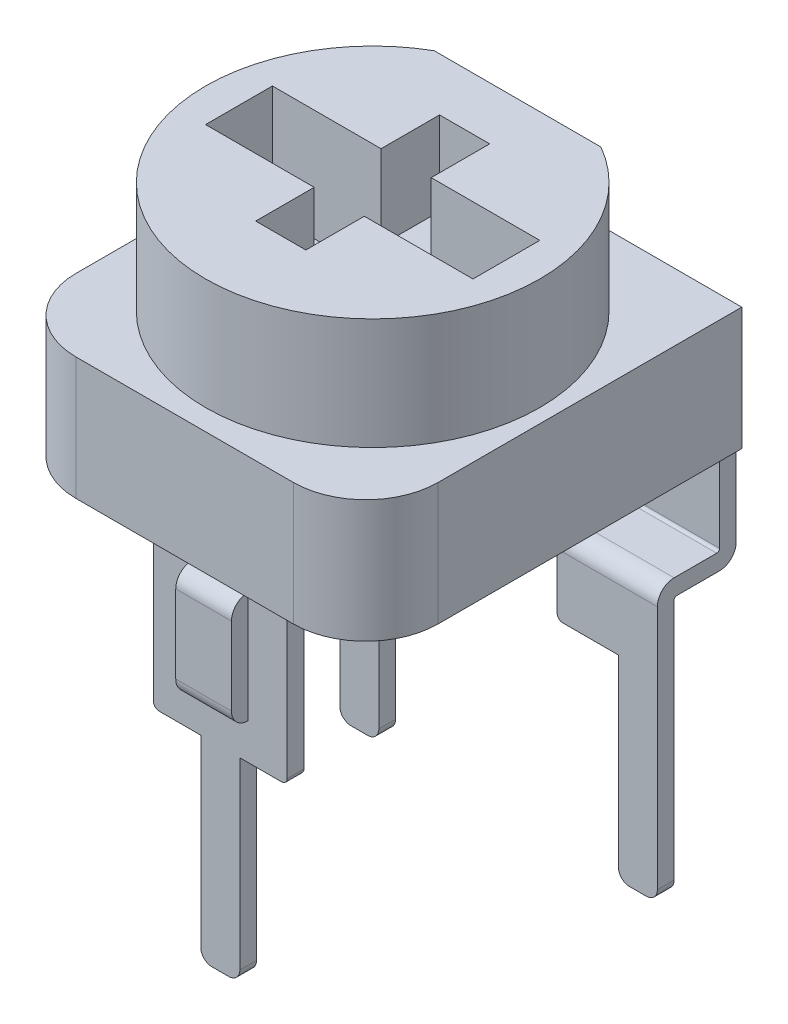
from build123d import *

# Parameters (mm, degrees)
BOSS_EXTRUDE1_DEPTH   = 2
SKETCH2_W             = 4.8
SKETCH2_H             = 1.2
CUT_EXTRUDE1_DEPTH    = 5.69041576
SKETCH3_W             = 0.9
SKETCH3_H             = 3.3
CUT_EXTRUDE2_DEPTH    = 1.5
BOSS_EXTRUDE2_DEPTH   = 2.2
SKETCH5_W             = 2.4
SKETCH5_H             = 0.3
BOSS_EXTRUDE3_DEPTH   = 3.2
SKETCH6_W             = 0.7
SKETCH6_H             = 0.3
BOSS_EXTRUDE4_DEPTH   = 3.5
FILLET1_R             = 0.1
FILLET2_R             = 0.2
SKETCH8_W             = 1
SKETCH8_H             = 2
BOSS_EXTRUDE5_DEPTH   = 0.3
FILLET3_R             = 0.3
SKETCH16_W            = 0.8
SKETCH16_H            = 1.4
CUT_EXTRUDE5_DEPTH    = 0.3
FILLET18_R            = 0.3
SKETCH9_W             = 1.8
SKETCH9_H             = 3
BOSS_EXTRUDE6_DEPTH   = 0.3
BOSS_EXTRUDE6_2_DEPTH = 0.3
FILLET4_R             = 0.3
FILLET5_R             = 0.3
SKETCH10_W            = 1.8
SKETCH10_H            = 1.415
BOSS_EXTRUDE7_DEPTH   = 0.3
FILLET6_R             = 0.3
FILLET7_R             = 0.3
FILLET8_R             = 0.05
FILLET9_R             = 0.05
SKETCH11_W            = 1.8
SKETCH11_H            = 0.3
BOSS_EXTRUDE8_DEPTH   = 1.1
FILLET10_R            = 0.3
FILLET11_R            = 0.3
FILLET12_R            = 0.05
FILLET13_R            = 0.05
SKETCH13_W            = 0.7
SKETCH13_H            = 0.3
BOSS_EXTRUDE9_DEPTH   = 3.5
FILLET14_R            = 0.2
SKETCH15_W            = 0.7
SKETCH15_H            = 0.3
BOSS_EXTRUDE10_DEPTH  = 3.5
FILLET15_R            = 0.2
FILLET16_R            = 0.1
FILLET17_R            = 0.1


with BuildPart() as part:
    # Sketch1 → Boss-Extrude1 (new body)
    with BuildSketch(Plane(origin=(0, 0, 0), x_dir=(1, 0, 0), z_dir=(0, 1, 0))):
        with BuildLine():
            Line((-1.496662955, 2.6), (1.496662955, 2.6))
            ThreePointArc((1.496662955, 2.6), (0, -3), (-1.496662955, 2.6))
        make_face()
    extrude(amount=BOSS_EXTRUDE1_DEPTH)

    # Sketch2 → Cut-Extrude1 (cut, through all)
    with BuildSketch(Plane(origin=(0, 2, 0), x_dir=(1, 0, 0), z_dir=(0, 1, 0))):
        Rectangle(SKETCH2_W, SKETCH2_H)
    extrude(amount=-CUT_EXTRUDE1_DEPTH, mode=Mode.SUBTRACT)

    # Sketch3 → Cut-Extrude2 (cut)
    with BuildSketch(Plane(origin=(0, 2, 0), x_dir=(1, 0, 0), z_dir=(0, 1, 0))):
        Rectangle(SKETCH3_W, SKETCH3_H)
    extrude(amount=-CUT_EXTRUDE2_DEPTH, mode=Mode.SUBTRACT)


with BuildPart() as body_2:
    # Sketch4 → Boss-Extrude2 (new body)
    with BuildSketch(Plane.XZ):
        with BuildLine():
            Line((-3.25, -3.375), (3.25, -3.375))
            Line((3.25, -3.375), (3.25, 2.075))
            ThreePointArc((3.25, 2.075), (2.869238816, 2.994238816), (1.95, 3.375))
            Line((1.95, 3.375), (-1.95, 3.375))
            ThreePointArc((-1.95, 3.375), (-2.869238816, 2.994238816), (-3.25, 2.075))
            Line((-3.25, 2.075), (-3.25, -3.375))
        make_face()
    extrude(amount=BOSS_EXTRUDE2_DEPTH)


with BuildPart() as body_3:
    # Sketch5 → Boss-Extrude3 (new body)
    with BuildSketch(Plane.XZ.offset(2.2)):
        with Locations((0, 2.585)):
            Rectangle(SKETCH5_W, SKETCH5_H)
    extrude(amount=BOSS_EXTRUDE3_DEPTH)

    # Sketch6 → Boss-Extrude4 (add)
    with BuildSketch(Plane.XZ.offset(5.4)):
        with Locations((0, 2.585)):
            Rectangle(SKETCH6_W, SKETCH6_H)
    extrude(amount=BOSS_EXTRUDE4_DEPTH)

    # Fillet1
    fillet1_edges = [body_3.edges().sort_by_distance(p)[0] for p in [
        (-1.2, -5.4, 2.585),
        (1.2, -5.4, 2.585),
    ]]
    fillet(fillet1_edges, radius=FILLET1_R)

    # Fillet2
    fillet2_edges = [body_3.edges().sort_by_distance(p)[0] for p in [
        (0.35, -8.9, 2.585),
        (-0.35, -8.9, 2.585),
    ]]
    fillet(fillet2_edges, radius=FILLET2_R)

    # Sketch8 → Boss-Extrude5 (add)
    with BuildSketch(Plane.XY.offset(2.735)):
        with Locations((0, -3.75)):
            Rectangle(SKETCH8_W, SKETCH8_H)
    extrude(amount=BOSS_EXTRUDE5_DEPTH)

    # Fillet3
    fillet3_edges = [body_3.edges().sort_by_distance(p)[0] for p in [
        (0, -4.75, 3.035),
        (0, -2.75, 3.035),
    ]]
    fillet(fillet3_edges, radius=FILLET3_R - 0.0001)  # a hair under: the kernel refuses the full size

    # Sketch16 → Cut-Extrude5 (cut)
    with BuildSketch(Plane(origin=(0, 0, 2.435), x_dir=(-1, 0, 0), z_dir=(0, 0, -1))):
        with Locations((0, -3.75)):
            Rectangle(SKETCH16_W, SKETCH16_H)
    extrude(amount=-CUT_EXTRUDE5_DEPTH, mode=Mode.SUBTRACT)

    # Fillet18
    fillet18_edges = [body_3.edges().sort_by_distance(p)[0] for p in [
        (0, -3.05, 2.735),
        (0, -4.45, 2.735),
    ]]
    fillet(fillet18_edges, radius=FILLET18_R - 0.0001)  # a hair under: the kernel refuses the full size


with BuildPart() as body_4:
    # Sketch9 → Boss-Extrude6 (new body)
    with BuildSketch(Plane(origin=(0, 0, -3.375), x_dir=(-1, 0, 0), z_dir=(0, 0, -1))):
        with Locations((-1.95, -2.5)):
            Rectangle(SKETCH9_W, SKETCH9_H)
    extrude(amount=BOSS_EXTRUDE6_DEPTH)

    # Fillet4
    fillet4_edges = [body_4.edges().sort_by_distance(p)[0] for p in [
        (1.95, -1, -3.675),
    ]]
    fillet(fillet4_edges, radius=FILLET4_R - 0.0001)  # a hair under: the kernel refuses the full size



with BuildPart() as body_5:
    # Sketch9 → Boss-Extrude6 2 (new body)
    with BuildSketch(Plane(origin=(0, 0, -3.375), x_dir=(-1, 0, 0), z_dir=(0, 0, -1))):
        with Locations((1.95, -2.5)):
            Rectangle(SKETCH9_W, SKETCH9_H)
    extrude(amount=BOSS_EXTRUDE6_2_DEPTH)

    # Fillet5
    fillet5_edges = [body_5.edges().sort_by_distance(p)[0] for p in [
        (-1.95, -1, -3.675),
    ]]
    fillet(fillet5_edges, radius=FILLET5_R - 0.0001)  # a hair under: the kernel refuses the full size


with BuildPart() as body_4_1:
    add(body_4.part)

    add(body_5.part)  # Boss-Extrude7 merges body 5
    # Sketch10 → Boss-Extrude7 (add)
    with BuildSketch(Plane.XZ.offset(4)):
        with Locations((-1.95, -2.9675)):
            Rectangle(SKETCH10_W, SKETCH10_H)
        with Locations((1.95, -2.9675)):
            Rectangle(SKETCH10_W, SKETCH10_H)
    extrude(amount=BOSS_EXTRUDE7_DEPTH)

    # Fillet6
    fillet6_edges = [body_4_1.edges().sort_by_distance(p)[0] for p in [
        (-1.95, -4.3, -3.675),
    ]]
    fillet(fillet6_edges, radius=FILLET6_R)

    # Fillet7
    fillet7_edges = [body_4_1.edges().sort_by_distance(p)[0] for p in [
        (1.95, -4.3, -3.675),
    ]]
    fillet(fillet7_edges, radius=FILLET7_R)

    # Fillet8
    fillet8_edges = [body_4_1.edges().sort_by_distance(p)[0] for p in [
        (1.95, -4, -3.375),
    ]]
    fillet(fillet8_edges, radius=FILLET8_R)

    # Fillet9
    fillet9_edges = [body_4_1.edges().sort_by_distance(p)[0] for p in [
        (-1.95, -4, -3.375),
    ]]
    fillet(fillet9_edges, radius=FILLET9_R)

    # Sketch11 → Boss-Extrude8 (add)
    with BuildSketch(Plane.XZ.offset(4.3)):
        with Locations((-1.95, -2.41)):
            Rectangle(SKETCH11_W, SKETCH11_H)
        with Locations((1.95, -2.41)):
            Rectangle(SKETCH11_W, SKETCH11_H)
    extrude(amount=BOSS_EXTRUDE8_DEPTH)

    # Fillet10
    fillet10_edges = [body_4_1.edges().sort_by_distance(p)[0] for p in [
        (-1.95, -4, -2.26),
    ]]
    fillet(fillet10_edges, radius=FILLET10_R)

    # Fillet11
    fillet11_edges = [body_4_1.edges().sort_by_distance(p)[0] for p in [
        (1.95, -4, -2.26),
    ]]
    fillet(fillet11_edges, radius=FILLET11_R)

    # Fillet12
    fillet12_edges = [body_4_1.edges().sort_by_distance(p)[0] for p in [
        (1.95, -4.3, -2.56),
    ]]
    fillet(fillet12_edges, radius=FILLET12_R)

    # Fillet13
    fillet13_edges = [body_4_1.edges().sort_by_distance(p)[0] for p in [
        (-1.95, -4.3, -2.56),
    ]]
    fillet(fillet13_edges, radius=FILLET13_R)

    # Sketch13 → Boss-Extrude9 (add)
    with BuildSketch(Plane(origin=(2.120815784, -5.4, -5.846545424), x_dir=(1, 0, 0), z_dir=(0, -1, 0))):
        with Locations((0.379184216, 3.436545424)):
            Rectangle(SKETCH13_W, SKETCH13_H)
    extrude(amount=BOSS_EXTRUDE9_DEPTH)

    # Fillet14
    fillet14_edges = [body_4_1.edges().sort_by_distance(p)[0] for p in [
        (2.85, -8.9, -2.41),
        (2.15, -8.9, -2.41),
    ]]
    fillet(fillet14_edges, radius=FILLET14_R)

    # Sketch15 → Boss-Extrude10 (add)
    with BuildSketch(Plane(origin=(-2.261414386, -5.4, -5.820113932), x_dir=(1, 0, 0), z_dir=(0, -1, 0))):
        with Locations((-0.238585614, 3.410113932)):
            Rectangle(SKETCH15_W, SKETCH15_H)
    extrude(amount=BOSS_EXTRUDE10_DEPTH)

    # Fillet15
    fillet15_edges = [body_4_1.edges().sort_by_distance(p)[0] for p in [
        (-2.15, -8.9, -2.41),
        (-2.85, -8.9, -2.41),
    ]]
    fillet(fillet15_edges, radius=FILLET15_R)

    # Fillet16
    fillet16_edges = [body_4_1.edges().sort_by_distance(p)[0] for p in [
        (1.05, -5.4, -2.41),
    ]]
    fillet(fillet16_edges, radius=FILLET16_R)

    # Fillet17
    fillet17_edges = [body_4_1.edges().sort_by_distance(p)[0] for p in [
        (-1.05, -5.4, -2.41),
    ]]
    fillet(fillet17_edges, radius=FILLET17_R)


solid = Compound([part.part, body_2.part, body_3.part, body_4_1.part])
